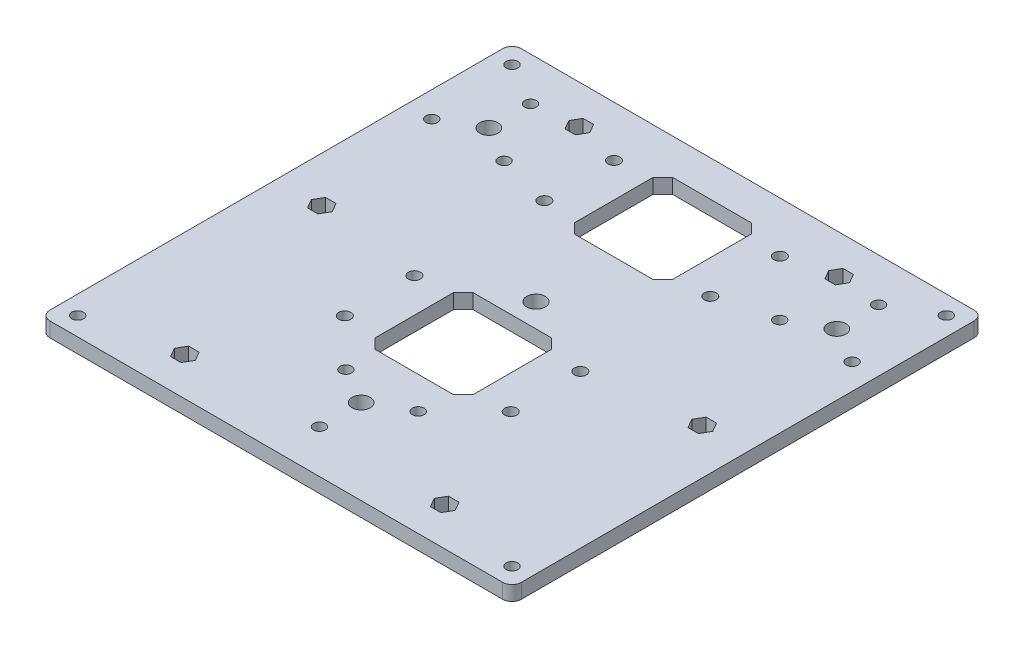
from build123d import *

# Parameters (mm, degrees)
ESQUISSE1_W                = 203.2
ESQUISSE1_H                = 203.2
BOSS_EXTRU_1_DEPTH         = 6.35
ESQUISSE2_R                = 3.925
ENL_V_MAT_EXTRU_1_DEPTH    = 144.824345992
ENL_V_MAT_EXTRU_2_DEPTH    = 144.824345992
ESQUISSE5_R                = 2.6
ENL_V_MAT_EXTRU_4_DEPTH    = 144.824345992
ESQUISSE6_R                = 2.5
ENL_V_MAT_EXTRU_5_DEPTH    = 144.824345992
ESQUISSE7_R                = 2.5
ENL_V_MAT_EXTRU_6_DEPTH    = 144.824345992
ESQUISSE8_R                = 4
ENL_V_MAT_EXTRU_7_DEPTH    = 144.824345992
ESQUISSE9_R                = 2.5
ENL_V_MAT_EXTRU_8_DEPTH    = 144.824345992
SYM_TRIE2_COPY_1_SKETCH_R  = 2.5
SYM_TRIE2_COPY_1_DEPTH     = 144.824345992
SYM_TRIE2_COPY_2_SKETCH_R  = 2.5
SYM_TRIE2_COPY_2_DEPTH     = 144.824345992
ENL_V_MAT_EXTRU_9_DEPTH    = 144.824345992
CONG_1_R                   = 4
ENL_V_MAT_EXTRU_10_DEPTH   = 144.824345992
R_P_TITION_LIN_AIRE3_COUNT = 2
R_P_TITION_LIN_AIRE3_PITCH = 86


with BuildPart() as part:
    # Esquisse1 → Boss.-Extru.1 (new body)
    with BuildSketch(Plane(origin=(0, 0, 0), x_dir=(1, 0, 0), z_dir=(0, 1, 0))):
        Rectangle(ESQUISSE1_W, ESQUISSE1_H)
    extrude(amount=BOSS_EXTRU_1_DEPTH)

    # Esquisse2 → Enlèv. mat.-Extru.1 (cut, through all)
    with BuildSketch(Plane(origin=(0, 6.35, 0), x_dir=(1, 0, 0), z_dir=(0, 1, 0))):
        with Locations((-75, 65)):
            Circle(ESQUISSE2_R)
        with Locations((75, 65)):
            Circle(ESQUISSE2_R)
        with Locations((0, -65)):
            Circle(ESQUISSE2_R)
    extrude(amount=-ENL_V_MAT_EXTRU_1_DEPTH, mode=Mode.SUBTRACT)

    # Esquisse3 → Enlèv. mat.-Extru.2 (cut, through all)
    with BuildSketch(Plane(origin=(0, 6.35, 0), x_dir=(1, 0, 0), z_dir=(0, 1, 0))):
        Polygon((-16.978069991, 86.15), (-21.15, 81.978069991), (-21.15, 48.021930009), (-16.978069991, 43.85), (16.978069991, 43.85), (21.15, 48.021930009), (21.15, 81.978069991), (16.978069991, 86.15), align=None)
    extrude(amount=-ENL_V_MAT_EXTRU_2_DEPTH, mode=Mode.SUBTRACT)

    # Esquisse5 → Enlèv. mat.-Extru.4 (cut, through all)
    with BuildSketch(Plane(origin=(0, 6.35, 0), x_dir=(1, 0, 0), z_dir=(0, 1, 0))):
        with Locations((-35.9, 49.85)):
            Circle(ESQUISSE5_R)
        with Locations((-35.9, 79.85)):
            Circle(ESQUISSE5_R)
        with Locations((35.6, 49.85)):
            Circle(ESQUISSE5_R)
        with Locations((35.6, 79.85)):
            Circle(ESQUISSE5_R)
    enl_v_mat_extru_4 = extrude(amount=-ENL_V_MAT_EXTRU_4_DEPTH, mode=Mode.SUBTRACT)

    # Esquisse6 → Enlèv. mat.-Extru.5 (cut, through all)
    with BuildSketch(Plane(origin=(0, 6.35, 0), x_dir=(1, 0, 0), z_dir=(0, 1, 0))):
        with Locations((93.6, -93.6)):
            Circle(ESQUISSE6_R)
        with Locations((-93.6, -93.6)):
            Circle(ESQUISSE6_R)
        with Locations((-93.6, 93.6)):
            Circle(ESQUISSE6_R)
        with Locations((93.6, 93.6)):
            Circle(ESQUISSE6_R)
    extrude(amount=-ENL_V_MAT_EXTRU_5_DEPTH, mode=Mode.SUBTRACT)

    # Esquisse7 → Enlèv. mat.-Extru.6 (cut, through all)
    with BuildSketch(Plane(origin=(0, 6.35, 0), x_dir=(1, 0, 0), z_dir=(0, 1, 0))):
        with Locations((15.588457268, -56)):
            Circle(ESQUISSE7_R)
        with Locations((-15.588457268, -56)):
            Circle(ESQUISSE7_R)
        with Locations((0, -83)):
            Circle(ESQUISSE7_R)
        with Locations((90.588457268, 56)):
            Circle(ESQUISSE7_R)
        with Locations((59.411542732, 56)):
            Circle(ESQUISSE7_R)
        with Locations((75, 83)):
            Circle(ESQUISSE7_R)
        with Locations((-90.589923123, 55.999154304)):
            Circle(ESQUISSE7_R)
        with Locations((-59.413008586, 55.999154304)):
            Circle(ESQUISSE7_R)
        with Locations((-75.001465855, 82.999154304)):
            Circle(ESQUISSE7_R)
    extrude(amount=-ENL_V_MAT_EXTRU_6_DEPTH, mode=Mode.SUBTRACT)

    # Esquisse8 → Enlèv. mat.-Extru.7 (cut, through all)
    with BuildSketch(Plane(origin=(0, 6.35, 0), x_dir=(1, 0, 0), z_dir=(0, 1, 0))):
        with Locations((0, 10.325)):
            Circle(ESQUISSE8_R)
    extrude(amount=-ENL_V_MAT_EXTRU_7_DEPTH, mode=Mode.SUBTRACT)

    # Esquisse9 → Enlèv. mat.-Extru.8 (cut, through all)
    with BuildSketch(Plane.XZ):
        with Locations((56, -85)):
            Circle(ESQUISSE9_R)
        with Locations((82, 0)):
            Circle(ESQUISSE9_R)
    enl_v_mat_extru_8 = extrude(amount=-ENL_V_MAT_EXTRU_8_DEPTH, mode=Mode.SUBTRACT)

    # Symétrie1: Enlèv. mat.-Extru.8 across plane
    add(enl_v_mat_extru_8.mirror(Plane.XY), mode=Mode.SUBTRACT)

    # Symétrie2 copy 1 sketch → Symétrie2 copy 1 (cut, through all)
    with BuildSketch(Plane(origin=(0, 0, 0), x_dir=(-1, 0, 0), z_dir=(0, -1, 0))):
        with Locations((56, -85)):
            Circle(SYM_TRIE2_COPY_1_SKETCH_R)
        with Locations((82, 0)):
            Circle(SYM_TRIE2_COPY_1_SKETCH_R)
    extrude(amount=-SYM_TRIE2_COPY_1_DEPTH, mode=Mode.SUBTRACT)

    # Symétrie2 copy 2 sketch → Symétrie2 copy 2 (cut, through all)
    with BuildSketch(Plane(origin=(0, 0, 0), x_dir=(-1, 0, 0), z_dir=(0, -1, 0))):
        with Locations((56, 85)):
            Circle(SYM_TRIE2_COPY_2_SKETCH_R)
        with Locations((82, 0)):
            Circle(SYM_TRIE2_COPY_2_SKETCH_R)
    extrude(amount=-SYM_TRIE2_COPY_2_DEPTH, mode=Mode.SUBTRACT)

    # Esquisse11 → Enlèv. mat.-Extru.9 (cut, through all)
    with BuildSketch(Plane.XZ):
        Polygon((-60.5033321, -85), (-58.25166605, -88.9), (-53.74833395, -88.9), (-51.4966679, -85), (-53.74833395, -81.1), (-58.25166605, -81.1), align=None)
        Polygon((-86.5033321, 0), (-84.25166605, -3.9), (-79.74833395, -3.9), (-77.4966679, 0), (-79.74833395, 3.9), (-84.25166605, 3.9), align=None)
        Polygon((-60.5033321, 85), (-58.25166605, 81.1), (-53.74833395, 81.1), (-51.4966679, 85), (-53.74833395, 88.9), (-58.25166605, 88.9), align=None)
        Polygon((51.4966679, 85), (53.74833395, 81.1), (58.25166605, 81.1), (60.5033321, 85), (58.25166605, 88.9), (53.74833395, 88.9), align=None)
        Polygon((77.4966679, 0), (79.74833395, -3.9), (84.25166605, -3.9), (86.5033321, 0), (84.25166605, 3.9), (79.74833395, 3.9), align=None)
        Polygon((60.5033321, -85), (58.25166605, -81.1), (53.74833395, -81.1), (51.4966679, -85), (53.74833395, -88.9), (58.25166605, -88.9), align=None)
    extrude(amount=-ENL_V_MAT_EXTRU_9_DEPTH, mode=Mode.SUBTRACT)

    # Congé1
    cong_1_edges = [part.edges().sort_by_distance(p)[0] for p in [
        (-101.6, 3.175, -101.6),
        (101.6, 3.175, -101.6),
        (101.6, 3.175, 101.6),
        (-101.6, 3.175, 101.6),
    ]]
    fillet(cong_1_edges, radius=CONG_1_R)

    # Esquisse13 → Enlèv. mat.-Extru.10 (cut, through all)
    with BuildSketch(Plane(origin=(0, 6.35, 0), x_dir=(1, 0, 0), z_dir=(0, 1, 0))):
        Polygon((-16.978069991, 0.149999997), (16.978069991, 0.149999997), (21.15, -4.021930012), (21.15, -37.978069994), (16.978069991, -42.150000003), (-16.978069991, -42.150000003), (-21.15, -37.978069994), (-21.15, -4.021930012), align=None)
    extrude(amount=-ENL_V_MAT_EXTRU_10_DEPTH, mode=Mode.SUBTRACT)

    # Répétition linéaire3: Enlèv. mat.-Extru.4 ×2
    with Locations(*[(0, 0, i * R_P_TITION_LIN_AIRE3_PITCH) for i in range(1, R_P_TITION_LIN_AIRE3_COUNT)]):
        add(enl_v_mat_extru_4, mode=Mode.SUBTRACT)


solid = part.part
